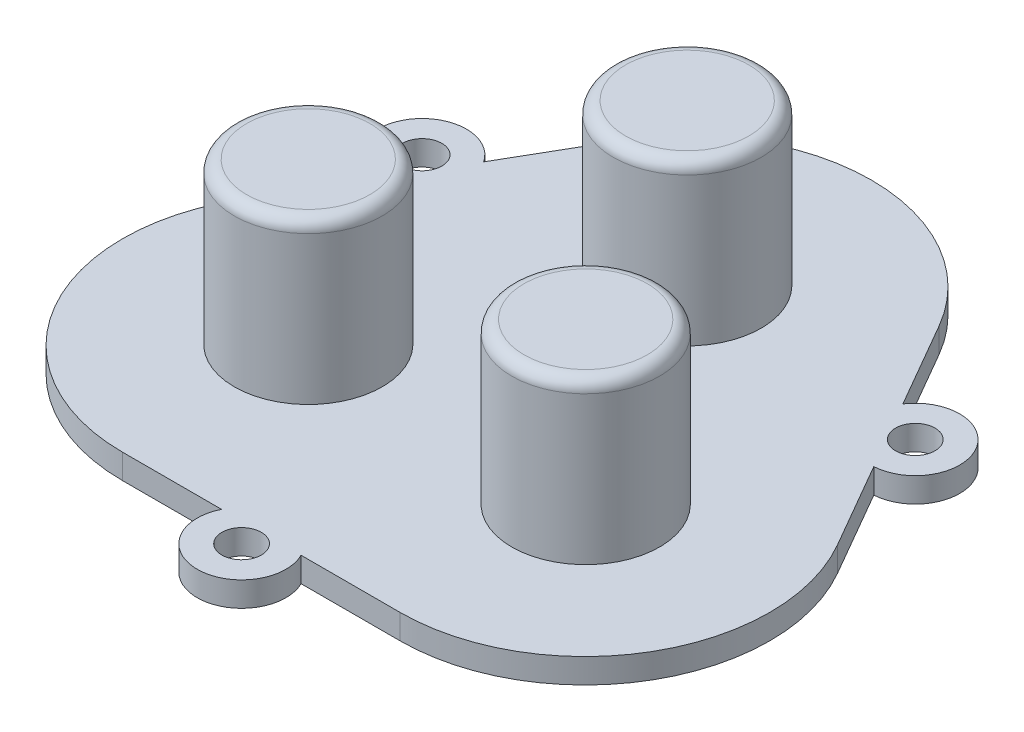
from build123d import *

# Parameters (mm, degrees)
SKETCH5_R           = 1.6
BOSS_EXTRUDE2_DEPTH = 2
SKETCH6_R           = 6
BOSS_EXTRUDE3_DEPTH = 15
FILLET1_R           = 1


with BuildPart() as part:
    # Sketch5 → Boss-Extrude2 (new body)
    with BuildSketch(Plane(origin=(0, 0, 0), x_dir=(1, 0, 0), z_dir=(0, 1, 0))):
        with BuildLine():
            Line((-11.250000051, -22.142785594), (-3.22490315, -22.142785594))
            ThreePointArc((-3.22490315, -22.142785594), (-5.1e-08, -27.342785594), (3.224903048, -22.142785594))
            Line((3.224903048, -22.142785594), (11.249999949, -22.142785594))
            ThreePointArc((11.249999949, -22.142785594), (24.240381006, -14.642785594), (24.240381006, 0.357214406))
            Line((24.240381006, 0.357214406), (20.227832555, 7.30715219))
            ThreePointArc((20.227832555, 7.30715219), (23.118713105, 12.700000199), (17.002929456, 12.892848208))
            Line((17.002929456, 12.892848208), (12.990381006, 19.842785992))
            ThreePointArc((12.990381006, 19.842785992), (-5.1e-08, 27.342785992), (-12.990381108, 19.842785992))
            Line((-12.990381108, 19.842785992), (-17.002929558, 12.892848208))
            ThreePointArc((-17.002929558, 12.892848208), (-23.118713208, 12.700000199), (-20.227832658, 7.30715219))
            Line((-20.227832658, 7.30715219), (-24.240381108, 0.357214406))
            ThreePointArc((-24.240381108, 0.357214406), (-24.240381108, -14.642785594), (-11.250000051, -22.142785594))
        make_face()
        with Locations((20.001021652, 10.900000199)):
            Circle(SKETCH5_R, mode=Mode.SUBTRACT)
        with Locations((-5.1e-08, -23.742785594)):
            Circle(SKETCH5_R, mode=Mode.SUBTRACT)
        with Locations((-20.001021754, 10.900000199)):
            Circle(SKETCH5_R, mode=Mode.SUBTRACT)
    extrude(amount=BOSS_EXTRUDE2_DEPTH)

    # Sketch6 → Boss-Extrude3 (add)
    with BuildSketch(Plane(origin=(0, 0, 0), x_dir=(1, 0, 0), z_dir=(0, 1, 0))):
        with Locations((-0.060025126, 12.462836141)):
            Circle(SKETCH6_R)
        with Locations((11.189974874, -7.022735444)):
            Circle(SKETCH6_R)
        with Locations((-11.310025126, -7.022735444)):
            Circle(SKETCH6_R)
    extrude(amount=BOSS_EXTRUDE3_DEPTH)

    # Fillet1
    fillet1_edges = [part.edges().sort_by_distance(p)[0] for p in [
        (-17.310025126, 15, 7.022735444),
        (5.189974874, 15, 7.022735444),
        (-6.060025126, 15, -12.462836141),
    ]]
    fillet(fillet1_edges, radius=FILLET1_R)


solid = part.part
